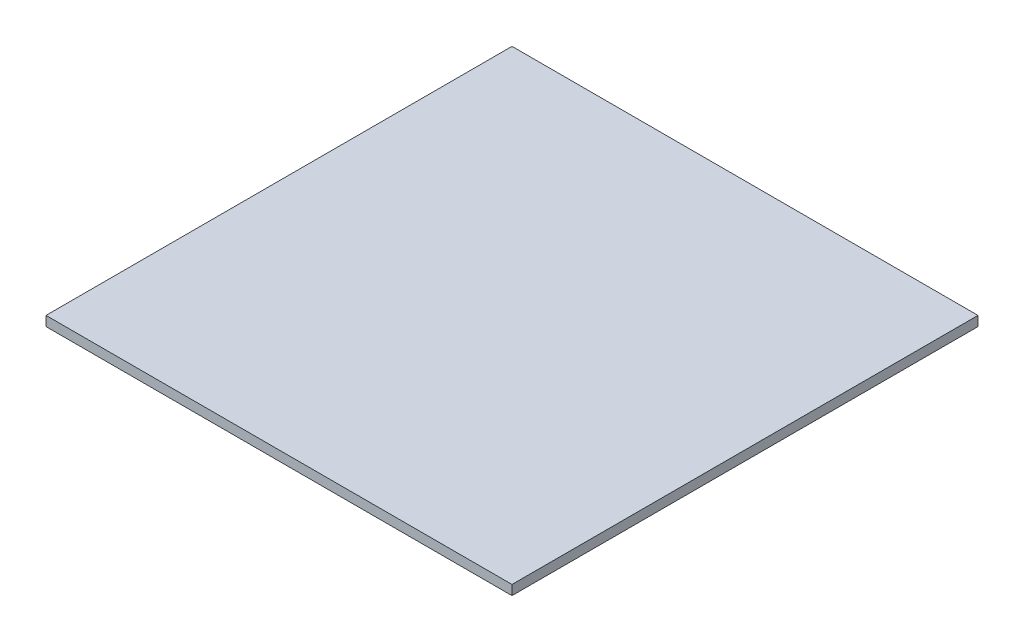
from build123d import *

# Parameters (mm, degrees)
SKETCH1_W           = 609.6
SKETCH1_H           = 609.6
BOSS_EXTRUDE1_DEPTH = 12.7


with BuildPart() as part:
    # Sketch1 → Boss-Extrude1 (new body)
    with BuildSketch(Plane(origin=(0, 0, 0), x_dir=(1, 0, 0), z_dir=(0, 1, 0))):
        with Locations((304.8, 304.8)):
            Rectangle(SKETCH1_W, SKETCH1_H)
    extrude(amount=BOSS_EXTRUDE1_DEPTH)


solid = part.part
